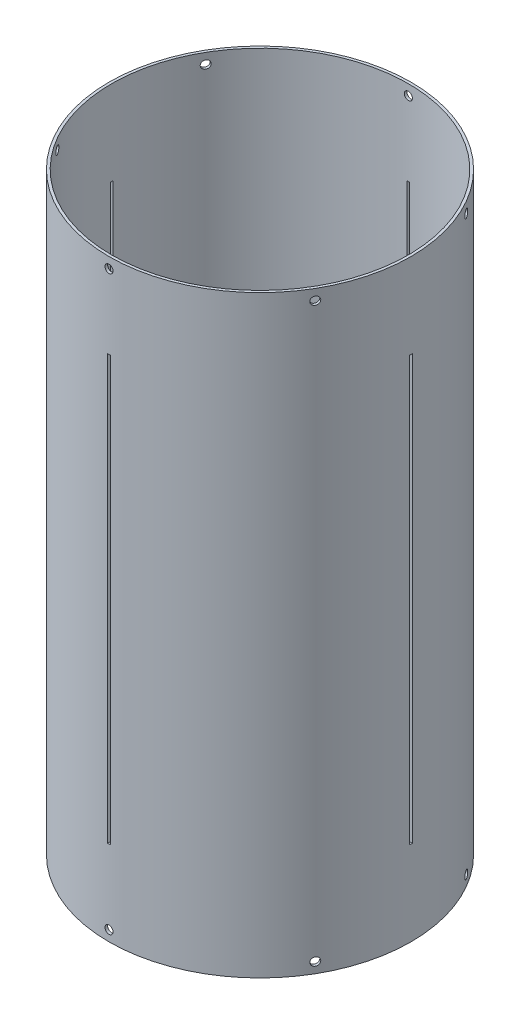
from build123d import *

# Parameters (mm, degrees)
SKETCH2_R           = 90.4875
SKETCH2_R_2         = 88.9
BOSS_EXTRUDE1_DEPTH = 355.6
SKETCH3_R           = 2.413
CUT_EXTRUDE1_DEPTH  = 378.925039277
CIRPATTERN1_COUNT   = 6
SKETCH4_W           = 1.5875
SKETCH4_H           = 254
CUT_EXTRUDE2_DEPTH  = 2.54
CIRPATTERN2_COUNT   = 4


with BuildPart() as part:
    # Sketch2 → Boss-Extrude1 (new body)
    with BuildSketch(Plane(origin=(0, 0, 0), x_dir=(1, 0, 0), z_dir=(0, 1, 0))):
        Circle(SKETCH2_R)
        Circle(SKETCH2_R_2, mode=Mode.SUBTRACT)
    extrude(amount=BOSS_EXTRUDE1_DEPTH)

    # Sketch3 → Cut-Extrude1 (cut, symmetric)
    with BuildSketch(Plane.XY):
        with Locations((0, 349.25)):
            Circle(SKETCH3_R)
        with Locations((0, 6.35)):
            Circle(SKETCH3_R)
    cut_extrude1 = extrude(amount=CUT_EXTRUDE1_DEPTH, both=True, mode=Mode.SUBTRACT)

    # CirPattern1: Cut-Extrude1 ×6 about axis
    cirpattern1_axis = Axis((0, 355.6, 0), (0, 1, 0))
    for i in range(1, CIRPATTERN1_COUNT):
        add(cut_extrude1.rotate(cirpattern1_axis, i * 360 / CIRPATTERN1_COUNT), mode=Mode.SUBTRACT)

    # Sketch4 → Cut-Extrude2 (cut)
    with BuildSketch(Plane.ZY.offset(90.4875)):
        with Locations((0, 177.8)):
            Rectangle(SKETCH4_W, SKETCH4_H)
    cut_extrude2 = extrude(amount=-CUT_EXTRUDE2_DEPTH, mode=Mode.SUBTRACT)

    # CirPattern2: Cut-Extrude2 ×4 about axis
    cirpattern2_axis = Axis((0, 355.6, 0), (0, 1, 0))
    for i in range(1, CIRPATTERN2_COUNT):
        add(cut_extrude2.rotate(cirpattern2_axis, i * 360 / CIRPATTERN2_COUNT), mode=Mode.SUBTRACT)


solid = part.part
